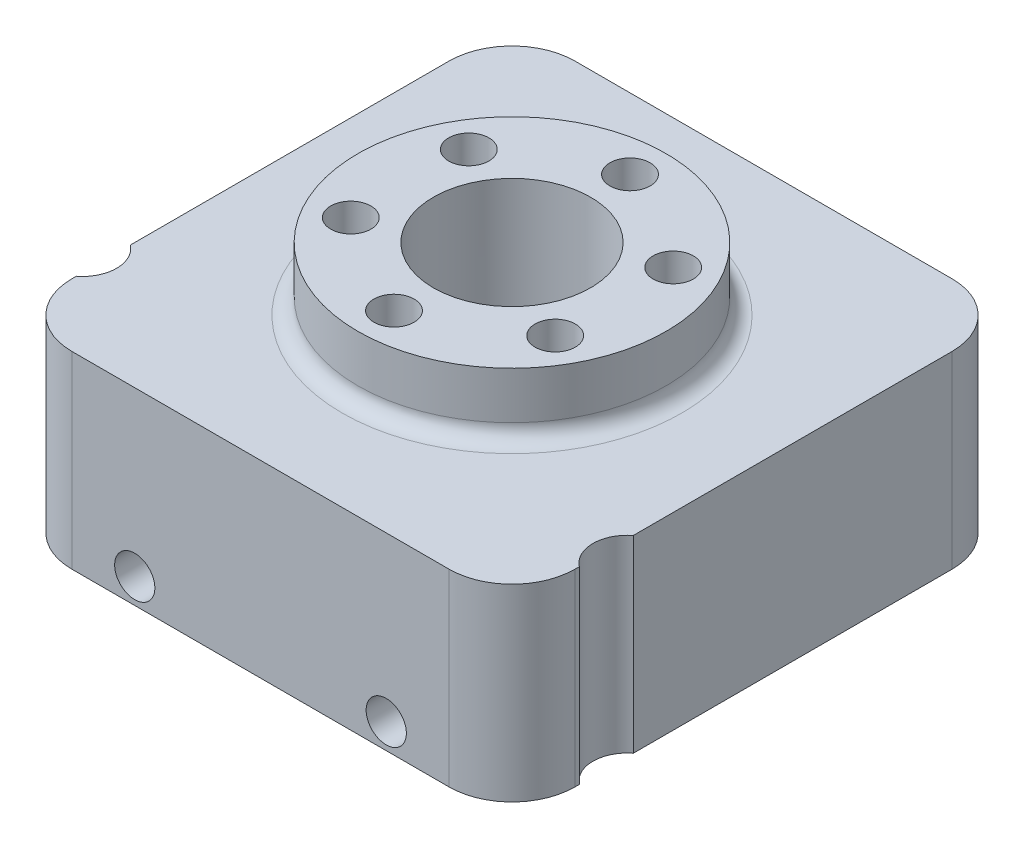
from build123d import *

# Parameters (mm, degrees)
SKETCH1_R           = 6.25
BOSS_EXTRUDE1_DEPTH = 15
SKETCH7_R           = 12.25
SKETCH7_R_2         = 6.25
BOSS_EXTRUDE2_DEPTH = 5
FILLET1_R           = 1.25
SKETCH3_R           = 1.6
SINGLE_SCREW_DEPTH  = 17
SKETCH2_R           = 1.6
DOUBLE_SCREW_DEPTH  = 10
SKETCH6_R           = 1.6
CUT_EXTRUDE1_DEPTH  = 35.641016267
CUT_EXTRUDE3_START  = -10
CUT_EXTRUDE3_DEPTH  = 5
FILLET2_R           = 5


with BuildPart() as part:
    # Sketch1 → Boss-Extrude1 (new body)
    with BuildSketch(Plane(origin=(0, 0, 0), x_dir=(1, 0, 0), z_dir=(0, 1, 0))):
        with BuildLine():
            Line((-20, -14.645854519), (-20, -20))
            Line((-20, -20), (20, -20))
            Line((20, -20), (20, -14.645854519))
            ThreePointArc((20, -14.645854519), (18.943369346, -12.5), (20, -10.354145481))
            Line((20, -10.354145481), (20, 20))
            Line((20, 20), (-20, 20))
            Line((-20, 20), (-20, -10.354145481))
            ThreePointArc((-20, -10.354145481), (-19.221849833, -11.304052681), (-18.943369346, -12.5))
            ThreePointArc((-18.943369346, -12.5), (-19.221849833, -13.695947319), (-20, -14.645854519))
        make_face()
        Circle(SKETCH1_R, mode=Mode.SUBTRACT)
    extrude(amount=BOSS_EXTRUDE1_DEPTH)

    # Sketch7 → Boss-Extrude2 (add)
    with BuildSketch(Plane(origin=(0, 15, 0), x_dir=(1, 0, 0), z_dir=(0, 1, 0))):
        Circle(SKETCH7_R)
        Circle(SKETCH7_R_2, mode=Mode.SUBTRACT)
    extrude(amount=BOSS_EXTRUDE2_DEPTH)

    # Fillet1
    fillet1_edges = [part.edges().sort_by_distance(p)[0] for p in [
        (-12.25, 15, 0),
    ]]
    fillet(fillet1_edges, radius=FILLET1_R)

    # Sketch3 → Single Screw (cut)
    with BuildSketch(Plane(origin=(0, 0, -20), x_dir=(-1, 0, 0), z_dir=(0, 0, -1))):
        with Locations((0, 3)):
            Circle(SKETCH3_R)
    extrude(amount=-SINGLE_SCREW_DEPTH, mode=Mode.SUBTRACT)

    # Sketch2 → Double Screw (cut)
    with BuildSketch(Plane.XY.offset(20)):
        with Locations((10, 2)):
            Circle(SKETCH2_R)
        with Locations((-10, 2)):
            Circle(SKETCH2_R)
    extrude(amount=-DOUBLE_SCREW_DEPTH, mode=Mode.SUBTRACT)

    # Sketch6 → Cut-Extrude1 (cut, through all)
    with BuildSketch(Plane(origin=(0, 20, 0), x_dir=(1, 0, 0), z_dir=(0, 1, 0))):
        with Locations((0, -9.385)):
            Circle(SKETCH6_R)
        with Locations((-8.127648415, -4.6925)):
            Circle(SKETCH6_R)
        with Locations((-8.127648415, 4.6925)):
            Circle(SKETCH6_R)
        with Locations((0, 9.385)):
            Circle(SKETCH6_R)
        with Locations((8.127648415, 4.6925)):
            Circle(SKETCH6_R)
        with Locations((8.127648415, -4.6925)):
            Circle(SKETCH6_R)
    extrude(amount=-CUT_EXTRUDE1_DEPTH, mode=Mode.SUBTRACT)

    # Sketch8 → Cut-Extrude3 (cut)
    with BuildSketch(Plane(origin=(0, 15, 0), x_dir=(1, 0, 0), z_dir=(0, 1, 0)).offset(CUT_EXTRUDE3_START)):
        with BuildLine():
            Line((-20, 5), (-20, -5))
            Line((-20, -5), (-20, -12.5))
            Line((-20, -12.5), (-13.964466094, -6.464466094))
            ThreePointArc((-13.964466094, -6.464466094), (-12.34234935, -5.380602337), (-10.428932188, -5))
            Line((-10.428932188, -5), (-3.75, -5))
            ThreePointArc((-3.75, -5), (-6.25, 0), (-3.75, 5))
            Line((-3.75, 5), (-10.428932188, 5))
            ThreePointArc((-10.428932188, 5), (-12.34234935, 5.380602337), (-13.964466094, 6.464466094))
            Line((-13.964466094, 6.464466094), (-20, 12.5))
            Line((-20, 12.5), (-20, 5))
        make_face()
    extrude(amount=CUT_EXTRUDE3_DEPTH, mode=Mode.SUBTRACT)

    # Fillet2
    fillet2_edges = [part.edges().sort_by_distance(p)[0] for p in [
        (20, 7.5, 20),
        (20, 7.5, -20),
        (-20, 7.5, -20),
        (-20, 7.5, 20),
    ]]
    fillet(fillet2_edges, radius=FILLET2_R)


solid = part.part
